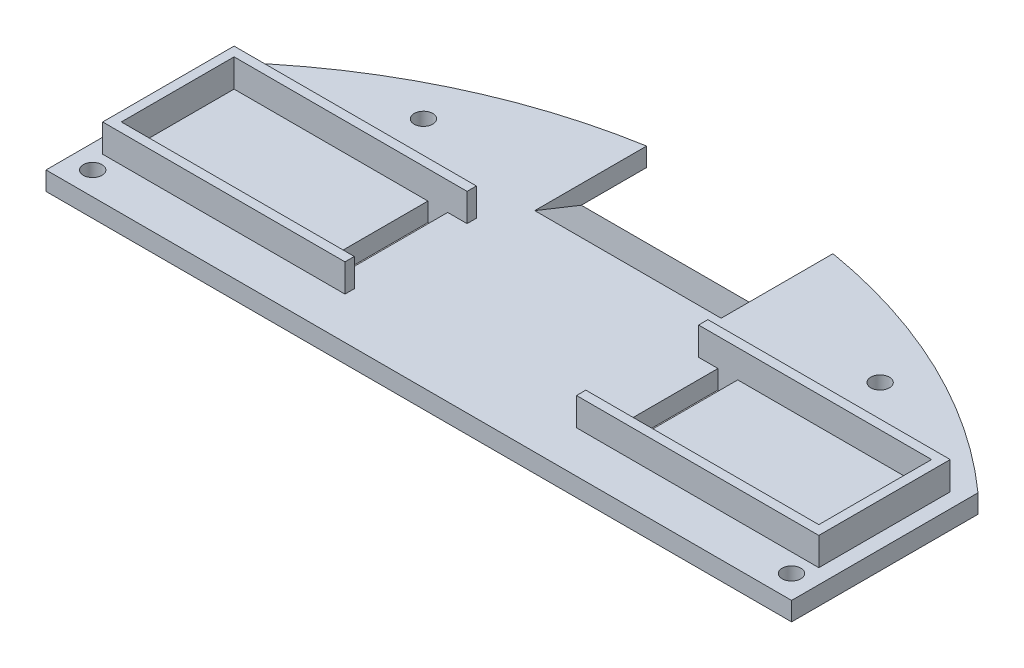
from build123d import *

# Parameters (mm, degrees)
SKETCH2_R           = 1
SKETCH2_W           = 2.12
SKETCH2_H           = 12.1
BOSS_EXTRUDE2_DEPTH = 2
BOSS_EXTRUDE3_DEPTH = 3
CHAMFER1_SIZE2      = 2
CHAMFER1_SIZE       = 5


with BuildPart() as part:
    # Sketch2 → Boss-Extrude2 (new body)
    with BuildSketch(Plane(origin=(0, 0, 0), x_dir=(1, 0, 0), z_dir=(0, 1, 0))):
        with BuildLine():
            Line((-10, 24.439438281), (-10, 17.439438281))
            Line((-10, 17.439438281), (10, 17.439438281))
            Line((10, 17.439438281), (10, 24.439438281))
            ThreePointArc((10, 24.439438281), (26.021613026, 19.342266443), (40, 10))
            Line((40, 10), (40, -10))
            Line((40, -10), (-40, -10))
            Line((-40, -10), (-40, 10))
            ThreePointArc((-40, 10), (-26.021613026, 19.342266443), (-10, 24.439438281))
        make_face()
        with Locations(Location((-37.490381057, -7.5, 0), (0, 0, 270))):
            Circle(SKETCH2_R, mode=Mode.SUBTRACT)
        with Locations(Location((37.490381057, -7.5, 0), (0, 0, 90))):
            Circle(SKETCH2_R, mode=Mode.SUBTRACT)
        with Locations(Location((-24.5, 15, 0), (0, 0, 270))):
            Circle(SKETCH2_R, mode=Mode.SUBTRACT)
        with Locations(Location((24.5, 15, 0), (0, 0, 90))):
            Circle(SKETCH2_R, mode=Mode.SUBTRACT)
        with Locations((15.56, 1.55)):
            Rectangle(SKETCH2_W, SKETCH2_H, mode=Mode.SUBTRACT)
        with Locations((-15.56, 1.55)):
            Rectangle(SKETCH2_W, SKETCH2_H, mode=Mode.SUBTRACT)
    extrude(amount=BOSS_EXTRUDE2_DEPTH)

    # Sketch3 → Boss-Extrude3 (add)
    with BuildSketch(Plane(origin=(0, 2, 0), x_dir=(1, 0, 0), z_dir=(0, 1, 0))):
        Polygon((12.419999998, -4.5), (37.42, -4.5), (37.42, 7.6), (12.419999998, 7.6), (12.419999998, 8.599999996), (38.419999998, 8.599999996), (38.419999998, -5.499999996), (12.419999998, -5.499999996), align=None)
        Polygon((-12.419999998, -4.5), (-12.419999998, -5.499999996), (-38.419999998, -5.499999996), (-38.419999998, 8.599999996), (-12.419999998, 8.599999996), (-12.419999998, 7.6), (-37.42, 7.6), (-37.42, -4.5), align=None)
    extrude(amount=BOSS_EXTRUDE3_DEPTH)

    # Chamfer1
    chamfer1_edges = [part.edges().sort_by_distance(p)[0] for p in [
        (0, 2, -17.439438281),
    ]]
    chamfer1_side = [part.faces().sort_by_distance(p)[0] for p in [
        (0, 2, -17.399438281),
    ]]
    chamfer(chamfer1_edges, length=CHAMFER1_SIZE - 0.0001, length2=CHAMFER1_SIZE2 - 0.0001, reference=chamfer1_side[0])  # a hair under: the kernel refuses the full size


solid = part.part
